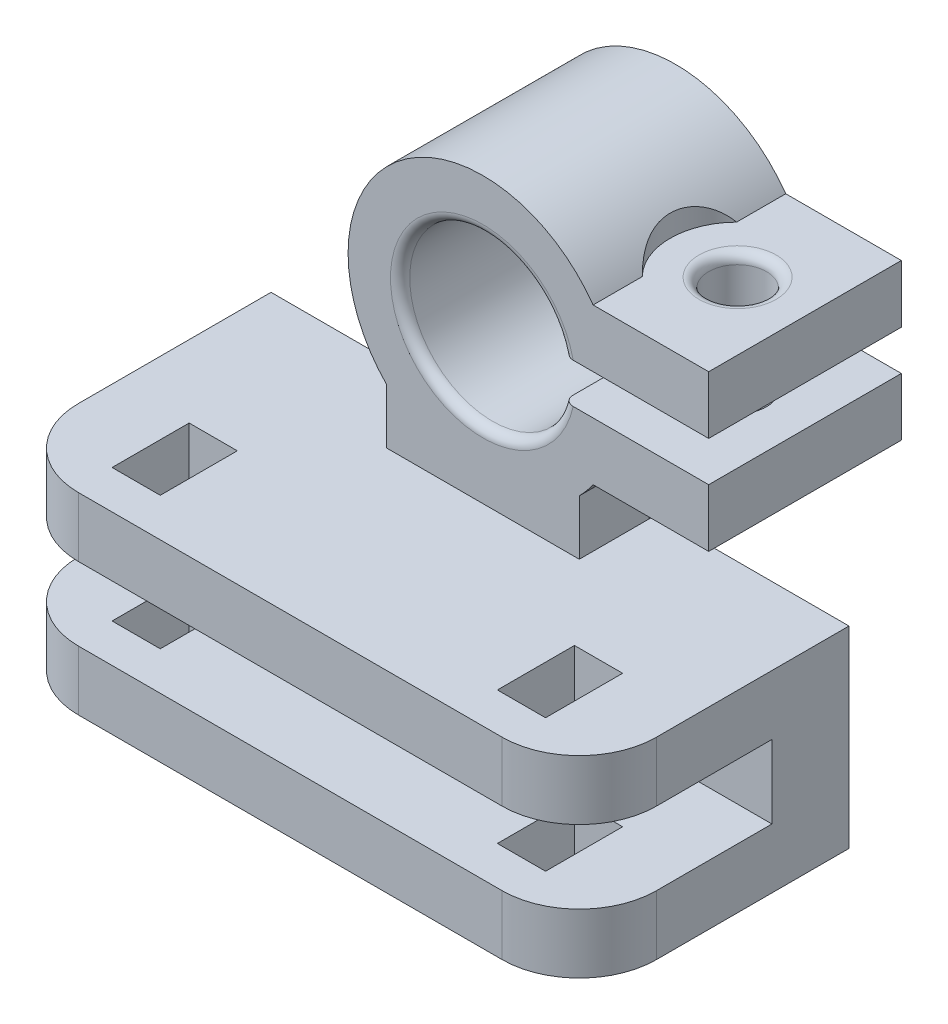
from build123d import *

# Parameters (mm, degrees)
ESBO_O1_W                     = 30
ESBO_O1_H                     = 10
RESSALTO_EXTRUS_O1_DEPTH      = 14
ESBO_O2_W                     = 30
ESBO_O2_H                     = 3.8
CORTE_EXTRUS_O1_DEPTH         = 10
FILETE1_R                     = 4
ESBO_O3_W                     = 2.5
ESBO_O3_H                     = 4
CORTE_EXTRUS_O2_DEPTH         = 23.825424421
RESSALTO_EXTRUS_O2_DEPTH      = 6
RESSALTO_EXTRUS_O2_DEPTH_BACK = 4
ESBO_O5_W                     = 10
ESBO_O5_H                     = 2.851020514
RESSALTO_EXTRUS_O3_DEPTH      = 8
CHANFRO1_SIZE2                = 9.900347414
CHANFRO1_SIZE                 = 4
CORTE_EXTRUS_O3_REACH         = 31.929
ESBO_O7_R                     = 1.5
FILETE2_R                     = 0.5
ESBO_O8_R                     = 3.5
CORTE_EXTRUS_O4_DEPTH         = 15
ESBO_O9_R                     = 3.5
CORTE_EXTRUS_O5_DEPTH         = 3.7


with BuildPart() as part:
    # Esboço1 → Ressalto-extrusão1 (new body)
    with BuildSketch(Plane.XY):
        Rectangle(ESBO_O1_W, ESBO_O1_H)
    extrude(amount=RESSALTO_EXTRUS_O1_DEPTH)

    # Esboço2 → Corte-extrusão1 (cut)
    with BuildSketch(Plane.XY.offset(14)):
        Rectangle(ESBO_O2_W, ESBO_O2_H)
    extrude(amount=-CORTE_EXTRUS_O1_DEPTH, mode=Mode.SUBTRACT)

    # Filete1
    filete1_edges = [part.edges().sort_by_distance(p)[0] for p in [
        (-15, 3.45, 14),
        (15, 3.45, 14),
        (-15, -3.45, 14),
        (15, -3.45, 14),
    ]]
    fillet(filete1_edges, radius=FILETE1_R)

    # Esboço3 → Corte-extrusão2 (cut, through all)
    with BuildSketch(Plane(origin=(0, 5, 0), x_dir=(1, 0, 0), z_dir=(0, 1, 0))):
        with Locations((10, -10)):
            Rectangle(ESBO_O3_W, ESBO_O3_H)
        with Locations((-10, -10)):
            Rectangle(ESBO_O3_W, ESBO_O3_H)
    extrude(amount=-CORTE_EXTRUS_O2_DEPTH, mode=Mode.SUBTRACT)


with BuildPart() as body_2:
    # Esboço4 → Ressalto-extrusão2 (new, two sides: drawn at the far end of the back side and taken through both)
    with BuildSketch(Plane(origin=(0, 0, 0), x_dir=(-1, 0, 0), z_dir=(0, 0, -1)).offset(-RESSALTO_EXTRUS_O2_DEPTH_BACK)):
        with BuildLine():
            Line((-4.17258046, 13.789024691), (-11.717191579, 13.789024691))
            Line((-11.717191579, 13.789024691), (-11.717191579, 16.789024691))
            Line((-11.717191579, 16.789024691), (-5.717191579, 16.789024691))
            ThreePointArc((-5.717191579, 16.789024691), (7, 12.75), (-5.717191579, 8.710975309))
            Line((-5.717191579, 8.710975309), (-11.717191579, 8.710975309))
            Line((-11.717191579, 8.710975309), (-11.717191579, 11.710975309))
            Line((-11.717191579, 11.710975309), (-4.17258046, 11.710975309))
            ThreePointArc((-4.17258046, 11.710975309), (4.3, 12.75), (-4.17258046, 13.789024691))
        make_face()
    extrude(amount=RESSALTO_EXTRUS_O2_DEPTH + RESSALTO_EXTRUS_O2_DEPTH_BACK)

    # Esboço5 → Ressalto-extrusão3 (add)
    with BuildSketch(Plane(origin=(0, 0, 4), x_dir=(-1, 0, 0), z_dir=(0, 0, -1))):
        with Locations((0, 6.425510257)):
            Rectangle(ESBO_O5_W, ESBO_O5_H)
    extrude(amount=RESSALTO_EXTRUS_O3_DEPTH)

    # Combinar1: union part
    add(part.part)

    # Chanfro1
    chanfro1_edges = [body_2.edges().sort_by_distance(p)[0] for p in [
        (0, 5, 0),
    ]]
    chanfro1_side = [body_2.faces().sort_by_distance(p)[0] for p in [
        (0, 5, -0.08),
    ]]
    chamfer(chanfro1_edges, length=CHANFRO1_SIZE - 0.0001, length2=CHANFRO1_SIZE2 - 0.0001, reference=chanfro1_side[0])  # a hair under: the kernel refuses the full size

    # Corte-extrusão3: up to this face of the body (flat: up to its plane)
    corte_extrus_o3_end = Plane(body_2.part.faces().sort_by_distance((8.717191579, 8.710975309, -1))[0])
    # Esboço7 → Corte-extrusão3 (cut, up to the picked face)
    with BuildSketch(Plane(origin=(0, 16.789024691, 0), x_dir=(1, 0, 0), z_dir=(0, 1, 0)), mode=Mode.PRIVATE) as corte_extrus_o3_sk1:
        with Locations(Location((8.217191579, 1, 0), (0, 0, 270))):
            Circle(ESBO_O7_R)
    corte_extrus_o3_tool1 = split(extrude(corte_extrus_o3_sk1.sketch, amount=-CORTE_EXTRUS_O3_REACH, mode=Mode.PRIVATE), bisect_by=corte_extrus_o3_end, keep=Keep.BOTH, mode=Mode.PRIVATE)
    add(corte_extrus_o3_tool1.solids().sort_by(Axis((8.217192, 16.789025, -1), (0, -1, 0)))[0], mode=Mode.SUBTRACT)

    # Filete2
    filete2_edges = [body_2.edges().sort_by_distance(p)[0] for p in [
        (8.217191579, 16.789024691, -2.5),
        (8.217191579, 8.710975309, -2.5),
        (-4.3, 12.75, -6),
        (-4.3, 12.75, 4),
    ]]
    fillet(filete2_edges, radius=FILETE2_R)

    # Esboço8 → Corte-extrusão4 (cut)
    with BuildSketch(Plane(origin=(0, 16.789024691, 0), x_dir=(1, 0, 0), z_dir=(0, 1, 0))):
        with Locations((8.217191579, 1)):
            Circle(ESBO_O8_R)
    extrude(amount=CORTE_EXTRUS_O4_DEPTH, mode=Mode.SUBTRACT)

    # Esboço9 → Corte-extrusão5 (cut)
    with BuildSketch(Plane.XZ.offset(-8.710975309)):
        with Locations((8.217191579, -1)):
            Circle(ESBO_O9_R)
    extrude(amount=CORTE_EXTRUS_O5_DEPTH, mode=Mode.SUBTRACT)


solid = body_2.part
